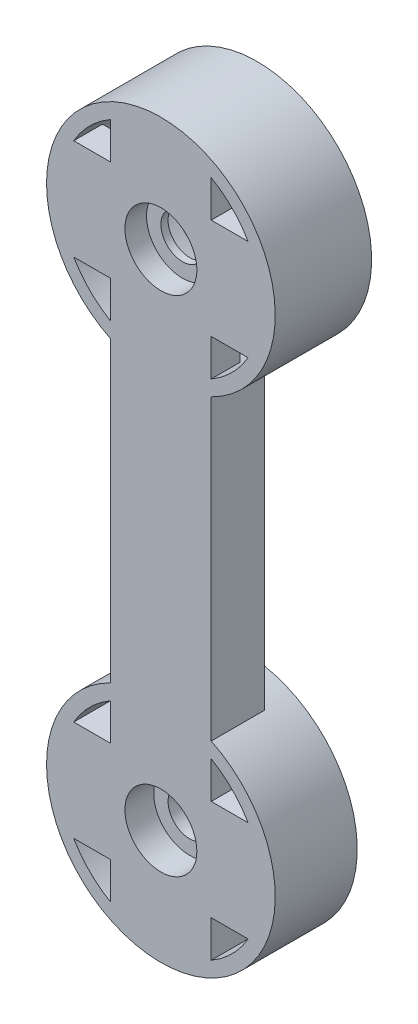
from build123d import *
from build123d.topology import SkipClean

# Parameters (mm, degrees)
SKETCH1_R           = 1.5
BOSS_EXTRUDE4_DEPTH = 3
BOSS_EXTRUDE5_START = 3
SKETCH3_R           = 7.95
SKETCH3_R_2         = 1.5
BOSS_EXTRUDE5_DEPTH = 3
SKETCH4_R           = 2.5
CUT_EXTRUDE1_DEPTH  = 1.5
SKETCH5_R           = 7
CUT_EXTRUDE2_DEPTH  = 4
SKETCH6_R           = 7.95
CUT_EXTRUDE3_DEPTH  = 1
SKETCH7_R           = 2.5
CUT_EXTRUDE4_DEPTH  = 0.5
BOSS_EXTRUDE6_START = 0.7
SKETCH8_R           = 7.95
SKETCH8_R_2         = 7
BOSS_EXTRUDE6_DEPTH = 0.7
BOSS_EXTRUDE8_START = 0.7
SKETCH9_R           = 7.95
SKETCH9_R_2         = 1.5
BOSS_EXTRUDE8_DEPTH = 0.7
BOSS_EXTRUDE9_START = 0.7
BOSS_EXTRUDE9_DEPTH = 0.7


with BuildPart() as part:
    # Sketch1 → Boss-Extrude4 (new body)
    with BuildSketch(Plane.XY):
        with BuildLine():
            Line((-3.5, -7.138101989), (-3.5, -27.861898011))
            ThreePointArc((-3.5, -27.861898011), (0, -42.95), (3.5, -27.861898011))
            Line((3.5, -27.861898011), (3.5, -7.138101989))
            ThreePointArc((3.5, -7.138101989), (0, 7.95), (-3.5, -7.138101989))
        make_face()
        with BuildLine():
            Line((-3.5, 6.062177826), (-3.5, 3.5))
            Line((-3.5, 3.5), (-6.062177826, 3.5))
            ThreePointArc((-6.062177826, 3.5), (-4.949747468, 4.949747468), (-3.5, 6.062177826))
        make_face(mode=Mode.SUBTRACT)
        with BuildLine():
            Line((3.5, 3.5), (3.5, 6.062177826))
            ThreePointArc((3.5, 6.062177826), (4.949747468, 4.949747468), (6.062177826, 3.5))
            Line((6.062177826, 3.5), (3.5, 3.5))
        make_face(mode=Mode.SUBTRACT)
        Circle(SKETCH1_R, mode=Mode.SUBTRACT)
        with BuildLine():
            Line((-6.062177826, -3.5), (-3.5, -3.5))
            Line((-3.5, -3.5), (-3.5, -6.062177826))
            ThreePointArc((-3.5, -6.062177826), (-4.949747468, -4.949747468), (-6.062177826, -3.5))
        make_face(mode=Mode.SUBTRACT)
        with BuildLine():
            Line((3.5, -3.5), (6.062177826, -3.5))
            ThreePointArc((6.062177826, -3.5), (4.949747468, -4.949747468), (3.5, -6.062177826))
            Line((3.5, -6.062177826), (3.5, -3.5))
        make_face(mode=Mode.SUBTRACT)
        with BuildLine():
            ThreePointArc((3.5, -28.937822174), (4.949747468, -30.050252532), (6.062177826, -31.5))
            Line((6.062177826, -31.5), (3.5, -31.5))
            Line((3.5, -31.5), (3.5, -28.937822174))
        make_face(mode=Mode.SUBTRACT)
        with BuildLine():
            Line((-3.5, -28.937822174), (-3.5, -31.5))
            Line((-3.5, -31.5), (-6.062177826, -31.5))
            ThreePointArc((-6.062177826, -31.5), (-4.949747468, -30.050252532), (-3.5, -28.937822174))
        make_face(mode=Mode.SUBTRACT)
        with BuildLine():
            ThreePointArc((-3.5, -41.062177826), (-4.949747468, -39.949747468), (-6.062177826, -38.5))
            Line((-6.062177826, -38.5), (-3.5, -38.5))
            Line((-3.5, -38.5), (-3.5, -41.062177826))
        make_face(mode=Mode.SUBTRACT)
        with BuildLine():
            ThreePointArc((6.062177826, -38.5), (4.949747468, -39.949747468), (3.5, -41.062177826))
            Line((3.5, -41.062177826), (3.5, -38.5))
            Line((3.5, -38.5), (6.062177826, -38.5))
        make_face(mode=Mode.SUBTRACT)
        with Locations((0, -35)):
            Circle(SKETCH1_R, mode=Mode.SUBTRACT)
    extrude(amount=BOSS_EXTRUDE4_DEPTH)

    # Sketch3 → Boss-Extrude5 (add)
    # profile 1 of 2: a face of its own
    with SkipClean():  # the faces are left unmerged after this step: merging them gives an invalid solid
        with BuildSketch(Plane(origin=(0, 0, 0), x_dir=(-1, 0, 0), z_dir=(0, 0, -1)).offset(BOSS_EXTRUDE5_START)):
            Circle(SKETCH3_R)
            with BuildLine():
                Line((3.5, 3.5), (3.5, 6.062177826))
                ThreePointArc((3.5, 6.062177826), (4.949747468, 4.949747468), (6.062177826, 3.5))
                Line((6.062177826, 3.5), (3.5, 3.5))
            make_face(mode=Mode.SUBTRACT)
            with BuildLine():
                Line((3.5, -3.5), (6.062177826, -3.5))
                ThreePointArc((6.062177826, -3.5), (4.949747468, -4.949747468), (3.5, -6.062177826))
                Line((3.5, -6.062177826), (3.5, -3.5))
            make_face(mode=Mode.SUBTRACT)
            with BuildLine():
                Line((-3.5, -3.5), (-3.5, -6.062177826))
                ThreePointArc((-3.5, -6.062177826), (-4.949747468, -4.949747468), (-6.062177826, -3.5))
                Line((-6.062177826, -3.5), (-3.5, -3.5))
            make_face(mode=Mode.SUBTRACT)
            with BuildLine():
                Line((-3.5, 3.5), (-6.062177826, 3.5))
                ThreePointArc((-6.062177826, 3.5), (-4.949747468, 4.949747468), (-3.5, 6.062177826))
                Line((-3.5, 6.062177826), (-3.5, 3.5))
            make_face(mode=Mode.SUBTRACT)
            Circle(SKETCH3_R_2, mode=Mode.SUBTRACT)
        # profile 2 of 2: a face of its own
        with BuildSketch(Plane(origin=(0, 0, 0), x_dir=(-1, 0, 0), z_dir=(0, 0, -1)).offset(BOSS_EXTRUDE5_START)):
            with Locations((0, -35)):
                Circle(SKETCH3_R)
            with BuildLine():
                Line((-3.5, -38.5), (-3.5, -41.062177826))
                ThreePointArc((-3.5, -41.062177826), (-4.949747468, -39.949747468), (-6.062177826, -38.5))
                Line((-6.062177826, -38.5), (-3.5, -38.5))
            make_face(mode=Mode.SUBTRACT)
            with BuildLine():
                Line((-3.5, -31.5), (-6.062177826, -31.5))
                ThreePointArc((-6.062177826, -31.5), (-4.949747468, -30.050252532), (-3.5, -28.937822174))
                Line((-3.5, -28.937822174), (-3.5, -31.5))
            make_face(mode=Mode.SUBTRACT)
            with BuildLine():
                Line((3.5, -31.5), (3.5, -28.937822174))
                ThreePointArc((3.5, -28.937822174), (4.949747468, -30.050252532), (6.062177826, -31.5))
                Line((6.062177826, -31.5), (3.5, -31.5))
            make_face(mode=Mode.SUBTRACT)
            with BuildLine():
                Line((3.5, -38.5), (6.062177826, -38.5))
                ThreePointArc((6.062177826, -38.5), (4.949747468, -39.949747468), (3.5, -41.062177826))
                Line((3.5, -41.062177826), (3.5, -38.5))
            make_face(mode=Mode.SUBTRACT)
            with Locations((0, -35)):
                Circle(SKETCH3_R_2, mode=Mode.SUBTRACT)
        extrude(amount=-BOSS_EXTRUDE5_DEPTH)

    # Sketch4 → Cut-Extrude1 (cut)
    with SkipClean():  # the faces are left unmerged after this step: merging them gives an invalid solid
        with BuildSketch(Plane.XY.offset(3)):
            with Locations((0, -35)):
                Circle(SKETCH4_R)
            Circle(SKETCH4_R)
        extrude(amount=-CUT_EXTRUDE1_DEPTH, mode=Mode.SUBTRACT)

    # Sketch5 → Cut-Extrude2 (cut)
    with SkipClean():  # the faces are left unmerged after this step: merging them gives an invalid solid
        with BuildSketch(Plane(origin=(0, 0, -3), x_dir=(-1, 0, 0), z_dir=(0, 0, -1))):
            Circle(SKETCH5_R)
        extrude(amount=-CUT_EXTRUDE2_DEPTH, mode=Mode.SUBTRACT)
    add(part.part.scale(1), mode=Mode.REPLACE)  # the faces are merged on a copy

    # Sketch6 → Cut-Extrude3 (cut)
    with BuildSketch(Plane(origin=(0, 0, -3), x_dir=(-1, 0, 0), z_dir=(0, 0, -1))):
        with Locations((0, -35)):
            Circle(SKETCH6_R)
    extrude(amount=-CUT_EXTRUDE3_DEPTH, mode=Mode.SUBTRACT)

    # Sketch7 → Cut-Extrude4 (cut)
    with BuildSketch(Plane.XY.offset(1.5)):
        with Locations((0, -35)):
            Circle(SKETCH7_R)
    extrude(amount=-CUT_EXTRUDE4_DEPTH, mode=Mode.SUBTRACT)

    # Sketch8 → Boss-Extrude6 (add)
    with BuildSketch(Plane(origin=(0, 0, -3), x_dir=(-1, 0, 0), z_dir=(0, 0, -1)).offset(BOSS_EXTRUDE6_START)):
        Circle(SKETCH8_R)
        Circle(SKETCH8_R_2, mode=Mode.SUBTRACT)
    extrude(amount=-BOSS_EXTRUDE6_DEPTH)

    # Sketch9 → Boss-Extrude8 (add)
    with SkipClean():  # the faces are left unmerged after this step: merging them gives an invalid solid
        with BuildSketch(Plane(origin=(0, 0, -2), x_dir=(-1, 0, 0), z_dir=(0, 0, -1)).offset(BOSS_EXTRUDE8_START)):
            with Locations((0, -35)):
                Circle(SKETCH9_R)
            with BuildLine():
                Line((3.5, -31.5), (3.5, -28.937822174))
                ThreePointArc((3.5, -28.937822174), (4.949747468, -30.050252532), (6.062177826, -31.5))
                Line((6.062177826, -31.5), (3.5, -31.5))
            make_face(mode=Mode.SUBTRACT)
            with BuildLine():
                Line((3.5, -38.5), (6.062177826, -38.5))
                ThreePointArc((6.062177826, -38.5), (4.949747468, -39.949747468), (3.5, -41.062177826))
                Line((3.5, -41.062177826), (3.5, -38.5))
            make_face(mode=Mode.SUBTRACT)
            with BuildLine():
                Line((-3.5, -38.5), (-3.5, -41.062177826))
                ThreePointArc((-3.5, -41.062177826), (-4.949747468, -39.949747468), (-6.062177826, -38.5))
                Line((-6.062177826, -38.5), (-3.5, -38.5))
            make_face(mode=Mode.SUBTRACT)
            with BuildLine():
                Line((-3.5, -31.5), (-6.062177826, -31.5))
                ThreePointArc((-6.062177826, -31.5), (-4.949747468, -30.050252532), (-3.5, -28.937822174))
                Line((-3.5, -28.937822174), (-3.5, -31.5))
            make_face(mode=Mode.SUBTRACT)
            with Locations((0, -35)):
                Circle(SKETCH9_R_2, mode=Mode.SUBTRACT)
        extrude(amount=-BOSS_EXTRUDE8_DEPTH)

    # Sketch10 → Boss-Extrude9 (add)
    with SkipClean():  # the faces are left unmerged after this step: merging them gives an invalid solid
        with BuildSketch(Plane(origin=(0, 0, 0), x_dir=(-1, 0, 0), z_dir=(0, 0, -1)).offset(BOSS_EXTRUDE9_START)):
            with BuildLine():
                ThreePointArc((3.5, -7.138101989), (0, -7.95), (-3.5, -7.138101989))
                Line((-3.5, -7.138101989), (-3.5, -27.861898011))
                ThreePointArc((-3.5, -27.861898011), (0, -27.05), (3.5, -27.861898011))
                Line((3.5, -27.861898011), (3.5, -7.138101989))
            make_face()
        extrude(amount=-BOSS_EXTRUDE9_DEPTH)


solid = part.part
